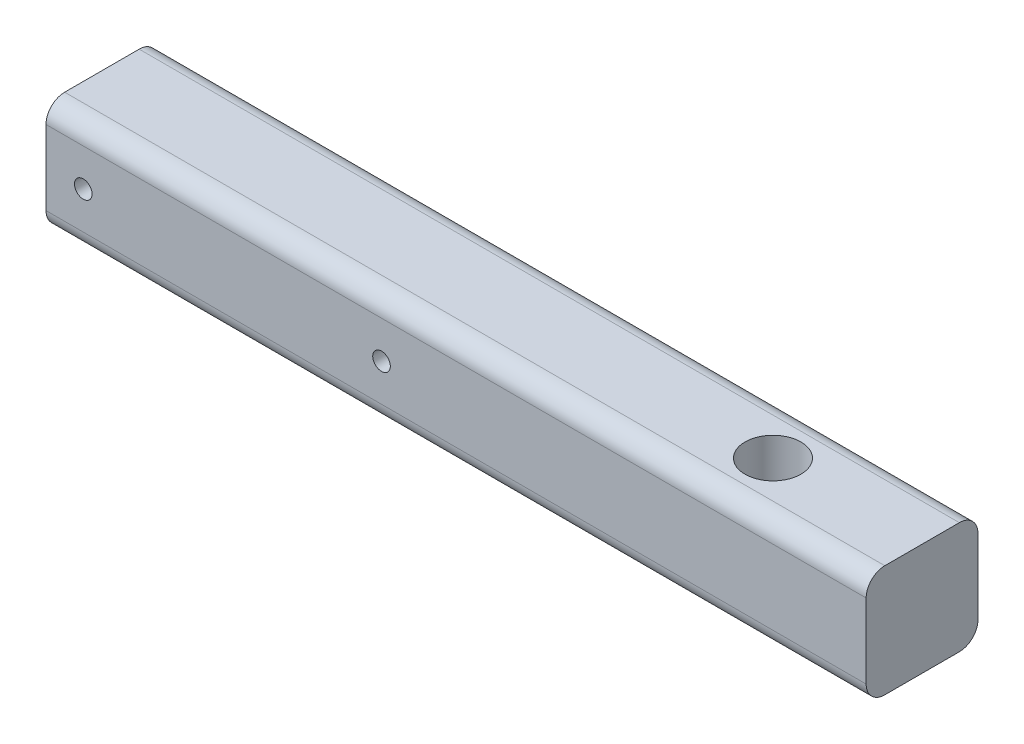
from build123d import *

# Parameters (mm, degrees)
SKETCH1_W           = 19.05
SKETCH1_H           = 19.05
BOSS_EXTRUDE1_DEPTH = 139.7
SKETCH2_R           = 4.7625
CUT_EXTRUDE1_DEPTH  = 142.314253085
SKETCH3_R           = 1.5
CUT_EXTRUDE2_DEPTH  = 142.314253085
FILLET1_R           = 3.175


with BuildPart() as part:
    # Sketch1 → Boss-Extrude1 (new body)
    with BuildSketch(Plane(origin=(0, 0, 0), x_dir=(0, 0, -1), z_dir=(1, 0, 0))):
        Rectangle(SKETCH1_W, SKETCH1_H)
    extrude(amount=BOSS_EXTRUDE1_DEPTH)

    # Sketch2 → Cut-Extrude1 (cut, through all)
    with BuildSketch(Plane(origin=(0, 9.525, 0), x_dir=(1, 0, 0), z_dir=(0, 1, 0))):
        with Locations((114.3, 0)):
            Circle(SKETCH2_R)
    extrude(amount=-CUT_EXTRUDE1_DEPTH, mode=Mode.SUBTRACT)

    # Sketch3 → Cut-Extrude2 (cut, through all)
    with BuildSketch(Plane.XY.offset(9.525)):
        with Locations((6.35, 0)):
            Circle(SKETCH3_R)
        with Locations((57.15, 0)):
            Circle(SKETCH3_R)
    extrude(amount=-CUT_EXTRUDE2_DEPTH, mode=Mode.SUBTRACT)

    # Fillet1
    fillet1_edges = [part.edges().sort_by_distance(p)[0] for p in [
        (69.85, -9.525, -9.525),
        (69.85, -9.525, 9.525),
        (69.85, 9.525, -9.525),
        (69.85, 9.525, 9.525),
    ]]
    fillet(fillet1_edges, radius=FILLET1_R)


solid = part.part
